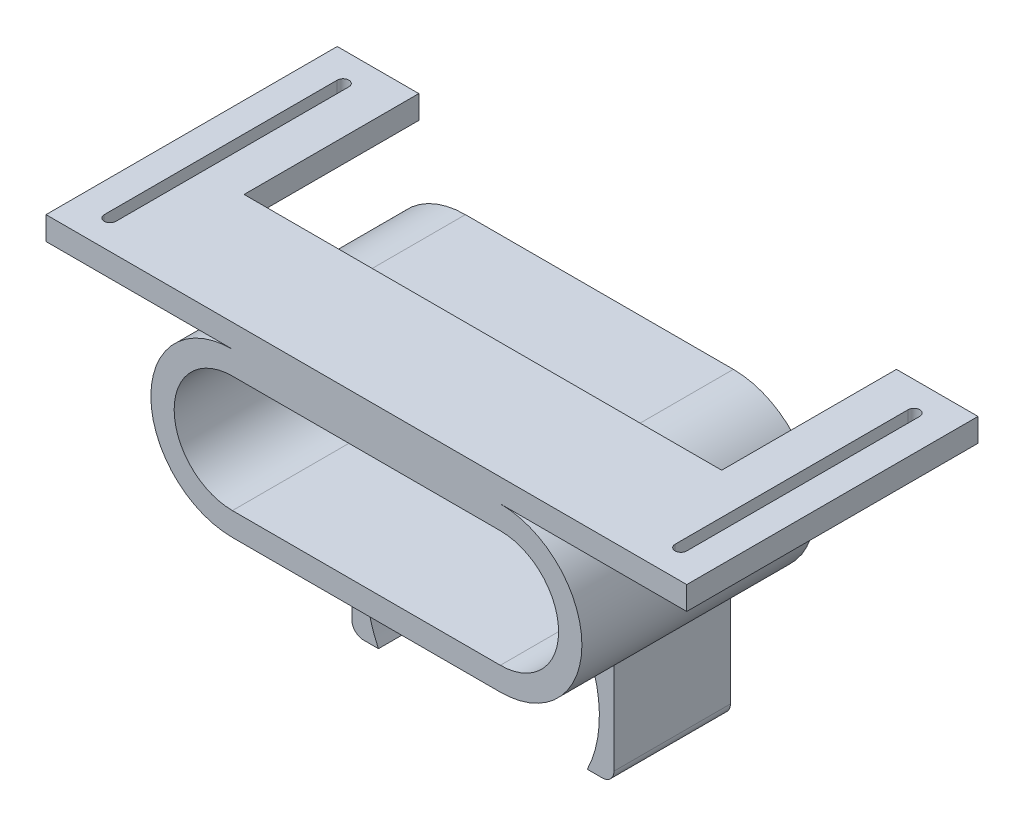
from build123d import *

# Parameters (mm, degrees)
BOSS_EXTRUDE1_DEPTH = 20
BOSS_EXTRUDE2_DEPTH = 10
FILLET1_R           = 3
FILLET2_R           = 1
BOSS_EXTRUDE4_DEPTH = 2
CUT_EXTRUDE1_REACH  = 44.805


with BuildPart() as part:
    # Sketch1 → Boss-Extrude1 (new body)
    with BuildSketch(Plane.XY):
        with BuildLine():
            Line((-11.5, 7), (11.5, 7))
            ThreePointArc((11.5, 7), (18.5, 0), (11.5, -7))
            Line((11.5, -7), (-11.5, -7))
            ThreePointArc((-11.5, -7), (-18.5, 0), (-11.5, 7))
        make_face()
        with BuildLine():
            Line((-11.5, 5), (11.5, 5))
            ThreePointArc((11.5, 5), (16.5, 0), (11.5, -5))
            Line((11.5, -5), (-11.5, -5))
            ThreePointArc((-11.5, -5), (-16.5, 0), (-11.5, 5))
        make_face(mode=Mode.SUBTRACT)
    extrude(amount=BOSS_EXTRUDE1_DEPTH)

    # Sketch2 → Boss-Extrude2 (add)
    with BuildSketch(Plane(origin=(0, 0, 0), x_dir=(-1, 0, 0), z_dir=(0, 0, -1))):
        with BuildLine():
            Line((11.25, -7), (6.75, -7))
            ThreePointArc((6.75, -7), (9.829603655, -12.636154321), (8.962619003, -19))
            Line((8.962619003, -19), (11.25, -19))
            Line((11.25, -19), (11.25, -7))
        make_face()
        with BuildLine():
            Line((-11.25, -19), (-8.962619003, -19))
            ThreePointArc((-8.962619003, -19), (-9.829603655, -12.636154321), (-6.75, -7))
            Line((-6.75, -7), (-11.25, -7))
            Line((-11.25, -7), (-11.25, -19))
        make_face()
    extrude(amount=-BOSS_EXTRUDE2_DEPTH)

    # Fillet1
    # the kernel refuses this fillet: 3 mm, written as the material it adds along each edge
    with BuildSketch(Plane(origin=(-11.25, -7, 0), x_dir=(-0.9923889232111901, 0.12314310816174315, 0), z_dir=(0, 0, 1))) as fillet1_piece_1:
        with BuildLine():
            CenterArc((2.655216223, 2.963972865), FILLET1_R, 187.073535236, 74.037985837)
            Line((-0.321950546, 2.594543541), (-0.619667223, 2.557600608))
            Line((-0.619667223, 2.557600608), (-0.297716677, -0.036942932))
            Line((-0.297716677, -0.036942932), (0.036942932, -0.297716677))
            ThreePointArc((0.036942932, -0.297716677), (0.285040163, -0.2669309), (2.145327536, -0.296397287))
            Line((2.145327536, -0.296397287), (2.191681053, 0))
        make_face()
    extrude(amount=10)
    with BuildSketch(Plane(origin=(11.25, -7, 0), x_dir=(0.9923889232111899, 0.12314310816174322, 0), z_dir=(0, 0, 1))) as fillet1_piece_2:
        with BuildLine():
            CenterArc((2.655216223, -2.963972865), FILLET1_R, 98.888478927, 74.037985837)
            Line((-0.321950546, -2.594543541), (-0.619667223, -2.557600608))
            Line((-0.619667223, -2.557600608), (-0.297716677, 0.036942932))
            Line((-0.297716677, 0.036942932), (0.036942932, 0.297716677))
            ThreePointArc((0.036942932, 0.297716677), (0.285040163, 0.2669309), (2.145327536, 0.296397287))
            Line((2.145327536, 0.296397287), (2.191681053, 0))
        make_face()
    extrude(amount=10)

    # Fillet2
    fillet2_edges = [part.edges().sort_by_distance(p)[0] for p in [
        (-6.75, -7, 5),
        (-11.25, -19, 5),
        (6.75, -7, 5),
        (11.25, -19, 5),
    ]]
    fillet(fillet2_edges, radius=FILLET2_R)

    # Sketch3 → Boss-Extrude4 (add)
    with BuildSketch(Plane(origin=(0, 7, 0), x_dir=(1, 0, 0), z_dir=(0, 1, 0))):
        Polygon((-27.5, -20), (27.5, -20), (27.5, 5), (20.5, 5), (20.5, -10), (-20.5, -10), (-20.5, 5), (-27.5, 5), align=None)
    extrude(amount=BOSS_EXTRUDE4_DEPTH)

    # Sketch4 → Cut-Extrude1 (cut, up to next)
    with BuildSketch(Plane.XZ.offset(-7), mode=Mode.PRIVATE) as cut_extrude1_sk1:
        with BuildLine():
            Line((-24, 17.5), (-24, -2.5))
            ThreePointArc((-24, -2.5), (-24.5, -3), (-25, -2.5))
            Line((-25, -2.5), (-25, 17.5))
            ThreePointArc((-25, 17.5), (-24.5, 18), (-24, 17.5))
        make_face()
    cut_extrude1_tool1 = extrude(cut_extrude1_sk1.sketch, amount=-CUT_EXTRUDE1_REACH, mode=Mode.PRIVATE) & part.part
    cut_extrude1 = cut_extrude1_tool1.solids().sort_by_distance((-24.5, 7, 7.5))[0]
    add(cut_extrude1, mode=Mode.SUBTRACT)

    # Mirror1: Cut-Extrude1 across plane
    add(cut_extrude1.mirror(Plane(origin=(0, 0, 0), x_dir=(0, 0, 1), z_dir=(1, 0, 0))), mode=Mode.SUBTRACT)


solid = part.part
